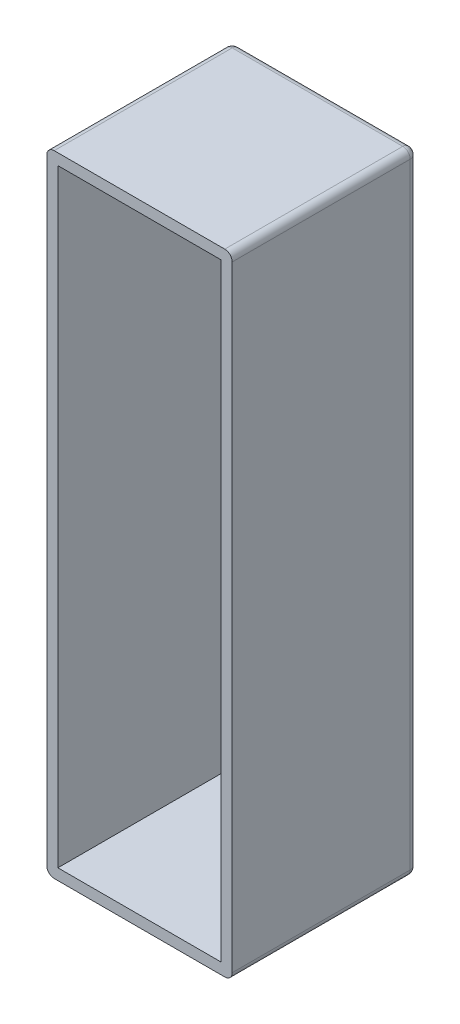
from build123d import *

# Parameters (mm, degrees)
SKETCH2_W           = 50
SKETCH2_H           = 170
BOSS_EXTRUDE1_DEPTH = 50
SKETCH3_W           = 44
SKETCH3_H           = 164
CUT_EXTRUDE1_DEPTH  = 47
FILLET2_R           = 2


with BuildPart() as part:
    # Sketch2 → Boss-Extrude1 (new body)
    with BuildSketch(Plane.XY):
        Rectangle(SKETCH2_W, SKETCH2_H)
    extrude(amount=BOSS_EXTRUDE1_DEPTH)

    # Sketch3 → Cut-Extrude1 (cut)
    with BuildSketch(Plane.XY.offset(50)):
        Rectangle(SKETCH3_W, SKETCH3_H)
    extrude(amount=-CUT_EXTRUDE1_DEPTH, mode=Mode.SUBTRACT)

    # Fillet2
    fillet2_edges = [part.edges().sort_by_distance(p)[0] for p in [
        (25, -85, 25),
        (25, 0, 0),
        (0, -85, 0),
        (-25, -85, 25),
        (-25, 0, 0),
        (25, 85, 25),
        (0, 85, 0),
        (-25, 85, 25),
    ]]
    fillet(fillet2_edges, radius=FILLET2_R)


solid = part.part
